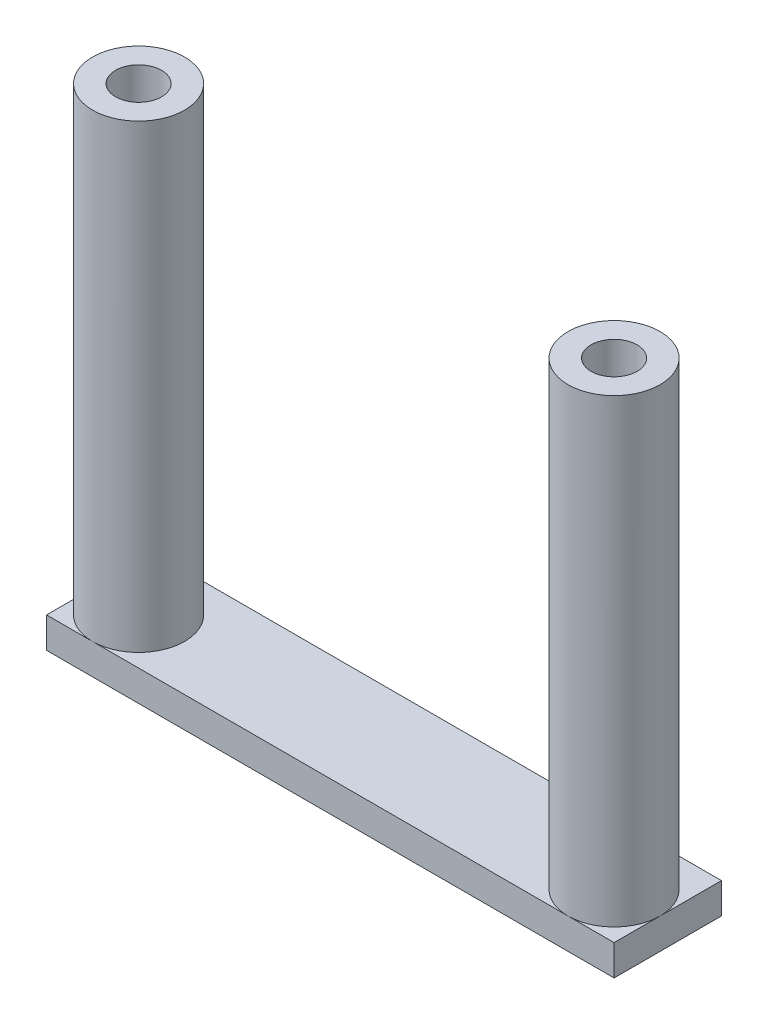
from build123d import *

# Parameters (mm, degrees)
SKETCH1_W           = 37
SKETCH1_H           = 31
SKETCH1_R           = 1.5
BOSS_EXTRUDE1_DEPTH = 2
SKETCH2_R           = 3
SKETCH2_R_2         = 1.5
BOSS_EXTRUDE2_DEPTH = 30
SKETCH3_W           = 37
SKETCH3_H           = 24
CUT_EXTRUDE1_DEPTH  = 55.442630355


with BuildPart() as part:
    # Sketch1 → Boss-Extrude1 (new body)
    with BuildSketch(Plane(origin=(0, 0, 0), x_dir=(1, 0, 0), z_dir=(0, 1, 0))):
        with Locations((15.5, 12.5)):
            Rectangle(SKETCH1_W, SKETCH1_H)
        with Locations((31, 0)):
            Circle(SKETCH1_R, mode=Mode.SUBTRACT)
        with Locations((31, 25)):
            Circle(SKETCH1_R, mode=Mode.SUBTRACT)
        with Locations((0, 25)):
            Circle(SKETCH1_R, mode=Mode.SUBTRACT)
        Circle(SKETCH1_R, mode=Mode.SUBTRACT)
    extrude(amount=BOSS_EXTRUDE1_DEPTH)

    # Sketch2 → Boss-Extrude2 (add)
    # profile 1 of 4: a face of its own
    with BuildSketch(Plane(origin=(0, 2, 0), x_dir=(1, 0, 0), z_dir=(0, 1, 0))):
        with Locations((0, 25)):
            Circle(SKETCH2_R)
        with Locations((0, 25)):
            Circle(SKETCH2_R_2, mode=Mode.SUBTRACT)
    # profile 2 of 4: a face of its own
    with BuildSketch(Plane(origin=(0, 2, 0), x_dir=(1, 0, 0), z_dir=(0, 1, 0))):
        with Locations((31, 25)):
            Circle(SKETCH2_R)
        with Locations((31, 25)):
            Circle(SKETCH2_R_2, mode=Mode.SUBTRACT)
    # profile 3 of 4: a face of its own
    with BuildSketch(Plane(origin=(0, 2, 0), x_dir=(1, 0, 0), z_dir=(0, 1, 0))):
        with Locations((31, 0)):
            Circle(SKETCH2_R)
        with Locations((31, 0)):
            Circle(SKETCH2_R_2, mode=Mode.SUBTRACT)
    # profile 4 of 4: a face of its own
    with BuildSketch(Plane(origin=(0, 2, 0), x_dir=(1, 0, 0), z_dir=(0, 1, 0))):
        Circle(SKETCH2_R)
        Circle(SKETCH2_R_2, mode=Mode.SUBTRACT)
    extrude(amount=BOSS_EXTRUDE2_DEPTH)

    # Sketch3 → Cut-Extrude1 (cut, through all)
    with BuildSketch(Plane.XZ):
        with Locations((15.5, -16)):
            Rectangle(SKETCH3_W, SKETCH3_H)
    extrude(amount=-CUT_EXTRUDE1_DEPTH, mode=Mode.SUBTRACT)


solid = part.part
